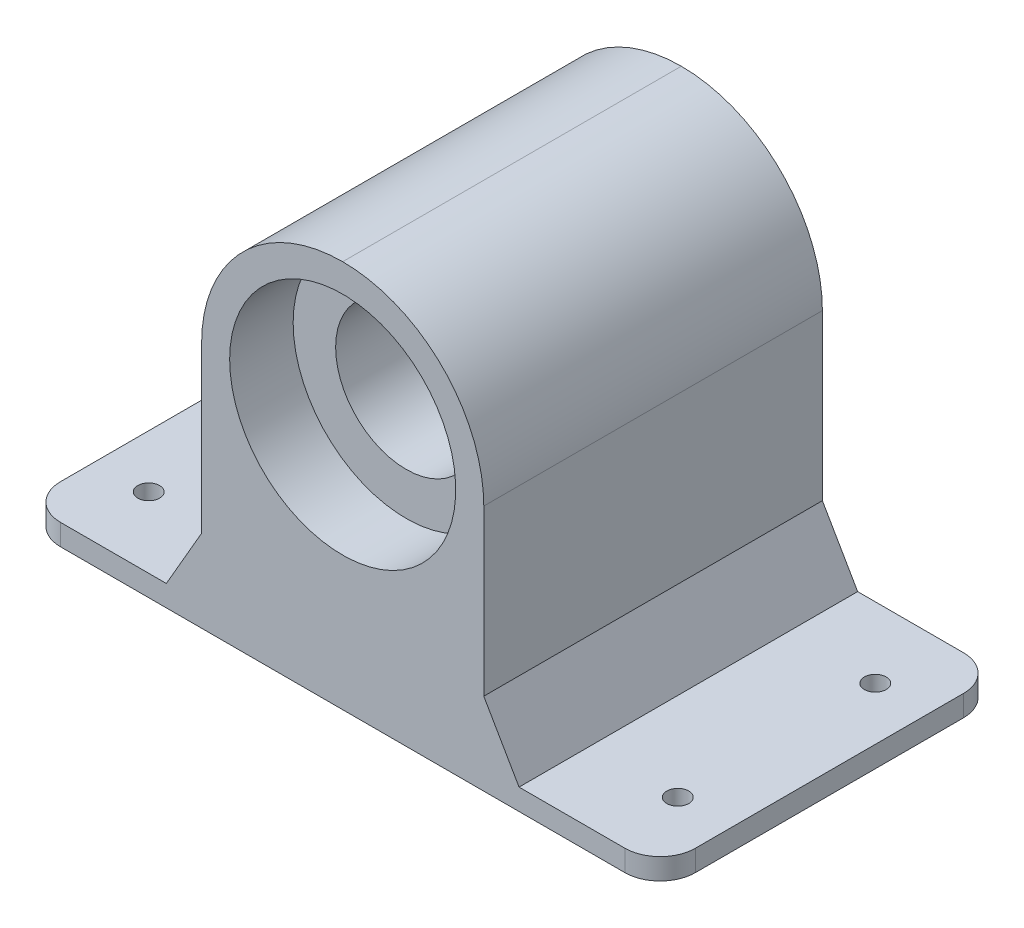
from build123d import *
from OCP.BRepFilletAPI import BRepFilletAPI_MakeChamfer

# Parameters (mm, degrees)
SKETCH_1_R          = 10
EXTRUDE_1_DEPTH     = 24
SKETCH_4_R          = 16.025
CUT_EXTRUDE_3_DEPTH = 9
SKETCH_5_W          = 48
SKETCH_5_H          = 3
EXTRUDE_2_DEPTH     = 25
CHAMFER_1_SIZE      = 5
CHAMFER_1_SIZE2     = 8.660254038
SKETCH_7_R          = 1.55
CUT_EXTRUDE_4_DEPTH = 76.00666637
FILLET_1_R          = 20
FILLET_2_R          = 5


with BuildPart() as part:
    # 草图1 → 凸台-拉伸1 (new, symmetric)
    with BuildSketch(Plane.XY):
        Polygon((-20, -35), (-20, 0), (-20, 20), (20, 20), (20, 0), (20, -35), align=None)
        Circle(SKETCH_1_R, mode=Mode.SUBTRACT)
    extrude(amount=EXTRUDE_1_DEPTH, both=True)

    # 草图4 → 切除-拉伸3 (cut)
    with BuildSketch(Plane(origin=(0, 0, -24), x_dir=(-1, 0, 0), z_dir=(0, 0, -1))):
        Circle(SKETCH_4_R)
    cut_extrude_3 = extrude(amount=-CUT_EXTRUDE_3_DEPTH, mode=Mode.SUBTRACT)

    # 镜向1: 切除-拉伸3 across plane
    add(cut_extrude_3.mirror(Plane.XY), mode=Mode.SUBTRACT)

    # 草图5 → 凸台-拉伸2 (add)
    with BuildSketch(Plane(origin=(20, 0, 0), x_dir=(0, 0, -1), z_dir=(1, 0, 0))):
        with Locations((0, -33.5)):
            Rectangle(SKETCH_5_W, SKETCH_5_H)
    extrude_2 = extrude(amount=EXTRUDE_2_DEPTH)

    # 镜向2: 凸台-拉伸2 across plane
    add(extrude_2.mirror(Plane.ZY))

    # 倒角1: one chamfer whose edges measure the first distance from different faces: ONE call of the kernel's chamfer builder (chamfer() names one face for all edges)
    chamfer_1_edges_1 = [part.edges().sort_by_distance(p)[0] for p in [
        (20, -32, 0),
    ]]
    chamfer_1_side_1 = [part.faces().sort_by_distance(p)[0] for p in [
        (32.5, -32, 0),
    ]]
    chamfer_1_edges_2 = [part.edges().sort_by_distance(p)[0] for p in [
        (-20, -32, 0),
    ]]
    chamfer_1_side_2 = [part.faces().sort_by_distance(p)[0] for p in [
        (-32.5, -32, 0),
    ]]
    chamfer_1 = BRepFilletAPI_MakeChamfer(part.part.solid().wrapped)
    for e in chamfer_1_edges_1:
        chamfer_1.Add(CHAMFER_1_SIZE, CHAMFER_1_SIZE2, e.wrapped, chamfer_1_side_1[0].wrapped)  # the first distance lies on this face
    for e in chamfer_1_edges_2:
        chamfer_1.Add(CHAMFER_1_SIZE, CHAMFER_1_SIZE2, e.wrapped, chamfer_1_side_2[0].wrapped)  # the first distance lies on this face
    add(Compound.cast(chamfer_1.Shape()), mode=Mode.REPLACE)

    # 草图7 → 切除-拉伸4 (cut, through all)
    with BuildSketch(Plane.XZ.offset(35)):
        with Locations(Location((37.5, 14, 0), (0, 0, 270))):
            Circle(SKETCH_7_R)
        with Locations(Location((37.5, -14, 0), (0, 0, 270))):
            Circle(SKETCH_7_R)
        with Locations(Location((-37.5, 14, 0), (0, 0, 90))):
            Circle(SKETCH_7_R)
        with Locations(Location((-37.5, -14, 0), (0, 0, 90))):
            Circle(SKETCH_7_R)
    extrude(amount=-CUT_EXTRUDE_4_DEPTH, mode=Mode.SUBTRACT)

    # 圆角1
    fillet_1_edges = [part.edges().sort_by_distance(p)[0] for p in [
        (20, 20, 0),
        (-20, 20, 0),
    ]]
    fillet(fillet_1_edges, radius=FILLET_1_R - 0.0001)  # a hair under: the kernel refuses the full size

    # 圆角2
    fillet_2_edges = [part.edges().sort_by_distance(p)[0] for p in [
        (45, -33.5, 24),
        (45, -33.5, -24),
        (-45, -33.5, 24),
        (-45, -33.5, -24),
    ]]
    fillet(fillet_2_edges, radius=FILLET_2_R)


solid = part.part
